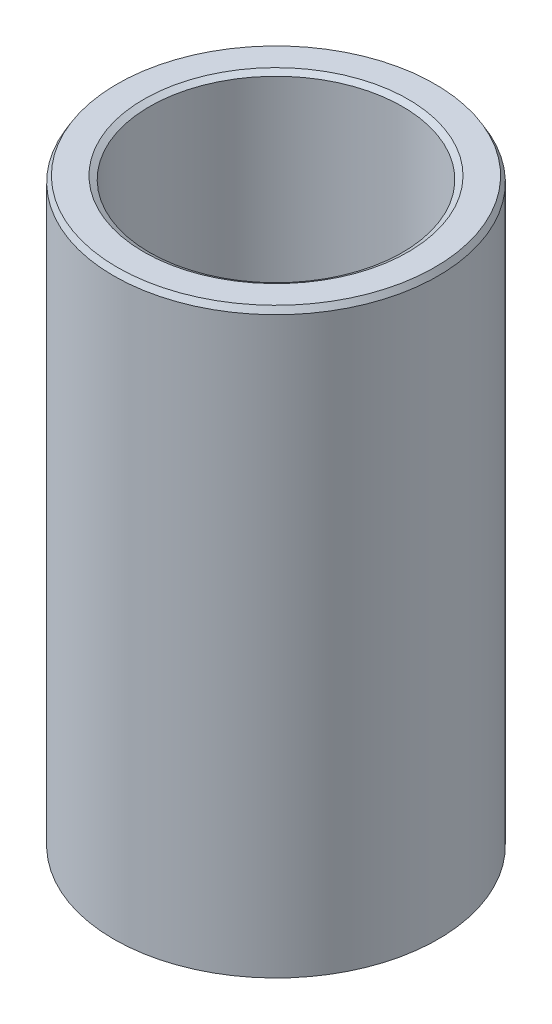
from build123d import *
from OCP.BRepFilletAPI import BRepFilletAPI_MakeChamfer

# Parameters (mm, degrees)
SKETCH1_R           = 47.5
BOSS_EXTRUDE1_DEPTH = 170.918902361
SKETCH2_R           = 37.036475966
CUT_EXTRUDE1_DEPTH  = 184.645776385
CHAMFER1_SIZE       = 1.700565907
CHAMFER1_SIZE2      = 0.981822184


with BuildPart() as part:
    # Sketch1 → Boss-Extrude1 (new body)
    with BuildSketch(Plane(origin=(0, 0, 0), x_dir=(1, 0, 0), z_dir=(0, 1, 0))):
        Circle(SKETCH1_R)
    extrude(amount=BOSS_EXTRUDE1_DEPTH)

    # Sketch2 → Cut-Extrude1 (cut, through all)
    with BuildSketch(Plane(origin=(0, 0, 0), x_dir=(1, 0, 0), z_dir=(0, 1, 0))):
        Circle(SKETCH2_R)
    extrude(amount=CUT_EXTRUDE1_DEPTH, mode=Mode.SUBTRACT)

    # Chamfer1: one chamfer whose edges measure the first distance from different faces: ONE call of the kernel's chamfer builder (chamfer() names one face for all edges)
    chamfer1_edges_1 = [part.edges().sort_by_distance(p)[0] for p in [
        (-37.036475966, 170.918902361, 0),
    ]]
    chamfer1_side_1 = [part.faces().sort_by_distance(p)[0] for p in [
        (-46.156497116, 170.918902361, 0),
    ]]
    chamfer1_edges_2 = [part.edges().sort_by_distance(p)[0] for p in [
        (-37.036475966, 0, 0),
    ]]
    chamfer1_side_2 = [part.faces().sort_by_distance(p)[0] for p in [
        (-37.036475966, 85.45945118, 0),
    ]]
    chamfer1_edges_3 = [part.edges().sort_by_distance(p)[0] for p in [
        (-47.5, 0, 0),
    ]]
    chamfer1_side_3 = [part.faces().sort_by_distance(p)[0] for p in [
        (-46.156497116, 0, 0),
    ]]
    chamfer1_edges_4 = [part.edges().sort_by_distance(p)[0] for p in [
        (-47.5, 170.918902361, 0),
    ]]
    chamfer1_side_4 = [part.faces().sort_by_distance(p)[0] for p in [
        (-47.5, 85.45945118, 0),
    ]]
    chamfer1 = BRepFilletAPI_MakeChamfer(part.part.solid().wrapped)
    for e in chamfer1_edges_1:
        chamfer1.Add(CHAMFER1_SIZE, CHAMFER1_SIZE2, e.wrapped, chamfer1_side_1[0].wrapped)  # the first distance lies on this face
    for e in chamfer1_edges_2:
        chamfer1.Add(CHAMFER1_SIZE, CHAMFER1_SIZE2, e.wrapped, chamfer1_side_2[0].wrapped)  # the first distance lies on this face
    for e in chamfer1_edges_3:
        chamfer1.Add(CHAMFER1_SIZE, CHAMFER1_SIZE2, e.wrapped, chamfer1_side_3[0].wrapped)  # the first distance lies on this face
    for e in chamfer1_edges_4:
        chamfer1.Add(CHAMFER1_SIZE, CHAMFER1_SIZE2, e.wrapped, chamfer1_side_4[0].wrapped)  # the first distance lies on this face
    add(Compound.cast(chamfer1.Shape()), mode=Mode.REPLACE)


solid = part.part
